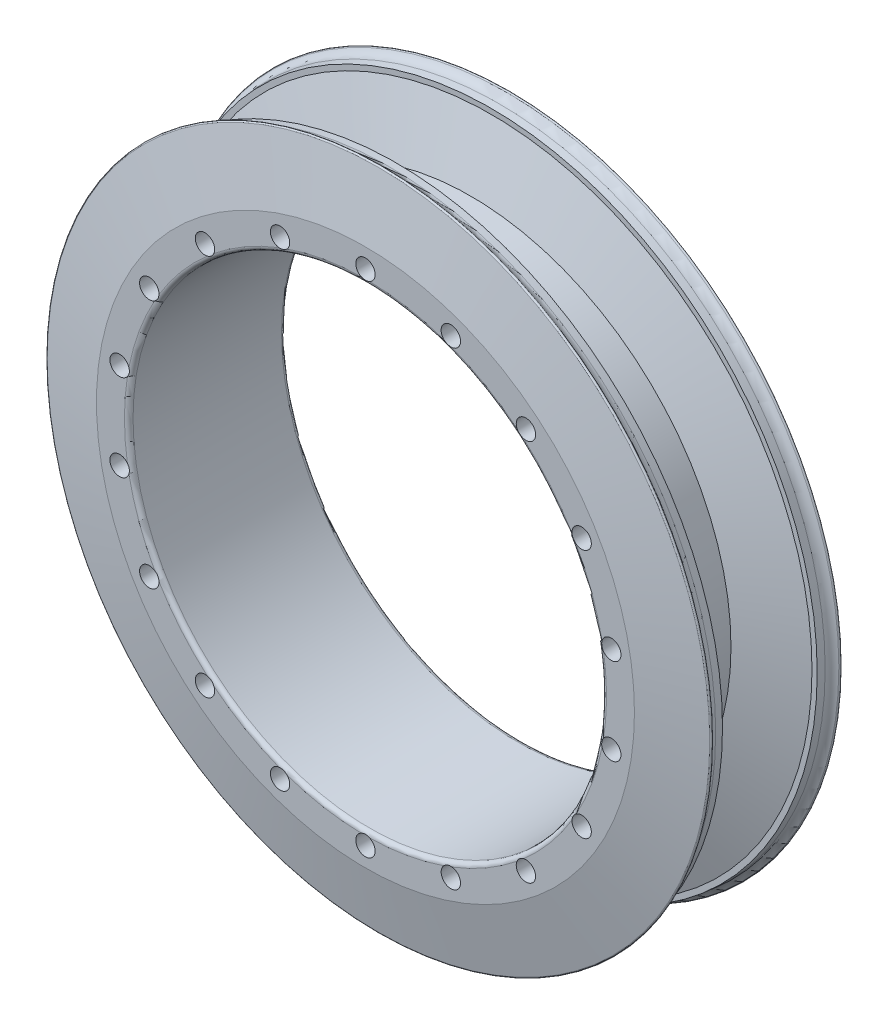
from build123d import *

# Parameters (mm, degrees)
CORTAR_EXTRUIR1_START = -6.18
CROQUIS3_R            = 2.25
CORTAR_EXTRUIR1_DEPTH = 293.591987551
CORTAR_EXTRUIR2_START = 6.18
CROQUIS4_R            = 2.25
CORTAR_EXTRUIR2_DEPTH = 293.591987557


with BuildPart() as part:
    # Croquis2 → Revolución2 (revolve)
    with BuildSketch(Plane(origin=(0, 0, 0), x_dir=(0, 0, -1), z_dir=(1, 0, 0))):
        with BuildLine():
            Line((-17.25, 253), (17.25, 253))
            ThreePointArc((17.25, 253), (17.957106781, 253.292893219), (18.25, 254))
            Line((18.25, 254), (18.25, 260.5))
            Line((18.25, 260.5), (15.227019128, 274.966873141))
            ThreePointArc((15.227019128, 274.966873141), (14.982692165, 275.201427222), (14.675490119, 275.058815213))
            ThreePointArc((14.675490119, 275.058815213), (13.845196603, 274.212393697), (12.718301276, 273.843715483))
            Line((12.718301276, 273.843715483), (11, 273.711538462))
            Line((11, 273.711538462), (11, 272.5))
            Line((11, 272.5), (6.179413414, 258.5))
            Line((6.179413414, 258.5), (-6.179413414, 258.5))
            Line((-6.179413414, 258.5), (-11, 272.5))
            Line((-11, 272.5), (-11, 273.711538462))
            Line((-11, 273.711538462), (-12.718301276, 273.843715483))
            ThreePointArc((-12.718301276, 273.843715483), (-13.845196603, 274.212393697), (-14.675490119, 275.058815213))
            ThreePointArc((-14.675490119, 275.058815213), (-14.982692165, 275.201427222), (-15.227019128, 274.966873141))
            Line((-15.227019128, 274.966873141), (-18.25, 260.5))
            Line((-18.25, 260.5), (-18.25, 254))
            ThreePointArc((-18.25, 254), (-17.957106781, 253.292893219), (-17.25, 253))
        make_face()
    revolve(axis=Axis((0, 198, 23.25), (0, 0, -1)))

    # Croquis3 → Cortar-Extruir1 (cut, through all)
    with BuildSketch(Plane.XY.offset(CORTAR_EXTRUIR1_START)):
        with Locations((0, 256)):
            Circle(CROQUIS3_R)
        with Locations((19.837168313, 252.502172006)):
            Circle(CROQUIS3_R)
        with Locations((37.281681362, 242.430577701)):
            Circle(CROQUIS3_R)
        with Locations((50.229473419, 227)):
            Circle(CROQUIS3_R)
        with Locations((57.118849675, 208.071594305)):
            Circle(CROQUIS3_R)
        with Locations((57.118849675, 187.928405695)):
            Circle(CROQUIS3_R)
        with Locations((50.229473419, 169)):
            Circle(CROQUIS3_R)
        with Locations((37.281681362, 153.569422299)):
            Circle(CROQUIS3_R)
        with Locations((19.837168313, 143.497827994)):
            Circle(CROQUIS3_R)
        with Locations((0, 140)):
            Circle(CROQUIS3_R)
        with Locations((-19.837168313, 143.497827994)):
            Circle(CROQUIS3_R)
        with Locations((-37.281681362, 153.569422299)):
            Circle(CROQUIS3_R)
        with Locations((-50.229473419, 169)):
            Circle(CROQUIS3_R)
        with Locations((-57.118849675, 187.928405695)):
            Circle(CROQUIS3_R)
        with Locations((-57.118849675, 208.071594305)):
            Circle(CROQUIS3_R)
        with Locations((-50.229473419, 227)):
            Circle(CROQUIS3_R)
        with Locations((-37.281681362, 242.430577701)):
            Circle(CROQUIS3_R)
        with Locations((-19.837168313, 252.502172006)):
            Circle(CROQUIS3_R)
    extrude(amount=CORTAR_EXTRUIR1_DEPTH, mode=Mode.SUBTRACT)

    # Croquis4 → Cortar-Extruir2 (cut, through all)
    with BuildSketch(Plane.XY.offset(CORTAR_EXTRUIR2_START)):
        with Locations((10.071594305, 255.118849675)):
            Circle(CROQUIS4_R)
        with Locations((29, 248.229473419)):
            Circle(CROQUIS4_R)
        with Locations((44.430577701, 235.281681362)):
            Circle(CROQUIS4_R)
        with Locations((54.502172006, 217.837168313)):
            Circle(CROQUIS4_R)
        with Locations((58, 198)):
            Circle(CROQUIS4_R)
        with Locations((54.502172006, 178.162831687)):
            Circle(CROQUIS4_R)
        with Locations((44.430577701, 160.718318638)):
            Circle(CROQUIS4_R)
        with Locations((29, 147.770526581)):
            Circle(CROQUIS4_R)
        with Locations((10.071594305, 140.881150325)):
            Circle(CROQUIS4_R)
        with Locations((-10.071594305, 140.881150325)):
            Circle(CROQUIS4_R)
        with Locations((-29, 147.770526581)):
            Circle(CROQUIS4_R)
        with Locations((-44.430577701, 160.718318638)):
            Circle(CROQUIS4_R)
        with Locations((-54.502172006, 178.162831687)):
            Circle(CROQUIS4_R)
        with Locations((-58, 198)):
            Circle(CROQUIS4_R)
        with Locations((-54.502172006, 217.837168313)):
            Circle(CROQUIS4_R)
        with Locations((-44.430577701, 235.281681362)):
            Circle(CROQUIS4_R)
        with Locations((-29, 248.229473419)):
            Circle(CROQUIS4_R)
        with Locations((-10.071594305, 255.118849675)):
            Circle(CROQUIS4_R)
    extrude(amount=-CORTAR_EXTRUIR2_DEPTH, mode=Mode.SUBTRACT)


solid = part.part
